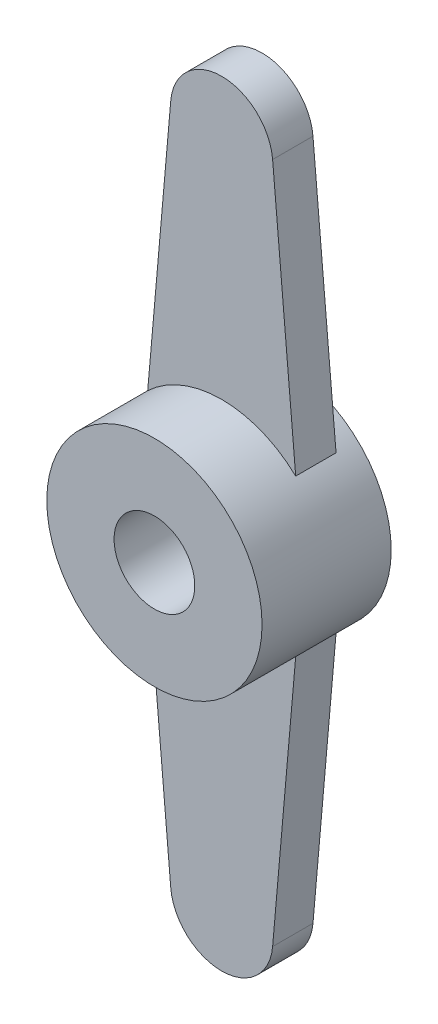
from build123d import *

# Parameters (mm, degrees)
BOSS_EXTRUDE1_DEPTH = 1.5
SKETCH2_R           = 4
BOSS_EXTRUDE2_DEPTH = 2.5
BOSS_EXTRUDE3_START = 0.8
SKETCH3_R           = 4
BOSS_EXTRUDE3_DEPTH = 0.8
SKETCH4_R           = 1.5
CUT_EXTRUDE1_DEPTH  = 16.697133496


with BuildPart() as part:
    # Sketch1 → Boss-Extrude1 (new body)
    with BuildSketch(Plane.XY):
        with BuildLine():
            Line((-1.892714844, 12.666224303), (-2.75, 2.90473751))
            ThreePointArc((-2.75, 2.90473751), (-4, 0), (-2.75, -2.90473751))
            Line((-2.75, -2.90473751), (-1.892714844, -12.666224303))
            ThreePointArc((-1.892714844, -12.666224303), (0, -14.4), (1.892714844, -12.666224303))
            Line((1.892714844, -12.666224303), (2.75, -2.90473751))
            ThreePointArc((2.75, -2.90473751), (4, 0), (2.75, 2.90473751))
            Line((2.75, 2.90473751), (1.892714844, 12.666224303))
            ThreePointArc((1.892714844, 12.666224303), (0, 14.4), (-1.892714844, 12.666224303))
        make_face()
    extrude(amount=BOSS_EXTRUDE1_DEPTH)

    # Sketch2 → Boss-Extrude2 (add)
    with BuildSketch(Plane.XY.offset(1.5)):
        Circle(SKETCH2_R)
    extrude(amount=BOSS_EXTRUDE2_DEPTH)

    # Sketch3 → Boss-Extrude3 (add)
    with BuildSketch(Plane(origin=(0, 0, 0), x_dir=(-1, 0, 0), z_dir=(0, 0, -1)).offset(BOSS_EXTRUDE3_START)):
        Circle(SKETCH3_R)
    extrude(amount=-BOSS_EXTRUDE3_DEPTH)

    # Sketch4 → Cut-Extrude1 (cut, through all)
    with BuildSketch(Plane(origin=(0, 0, -0.8), x_dir=(-1, 0, 0), z_dir=(0, 0, -1))):
        Circle(SKETCH4_R)
    extrude(amount=-CUT_EXTRUDE1_DEPTH, mode=Mode.SUBTRACT)


solid = part.part
